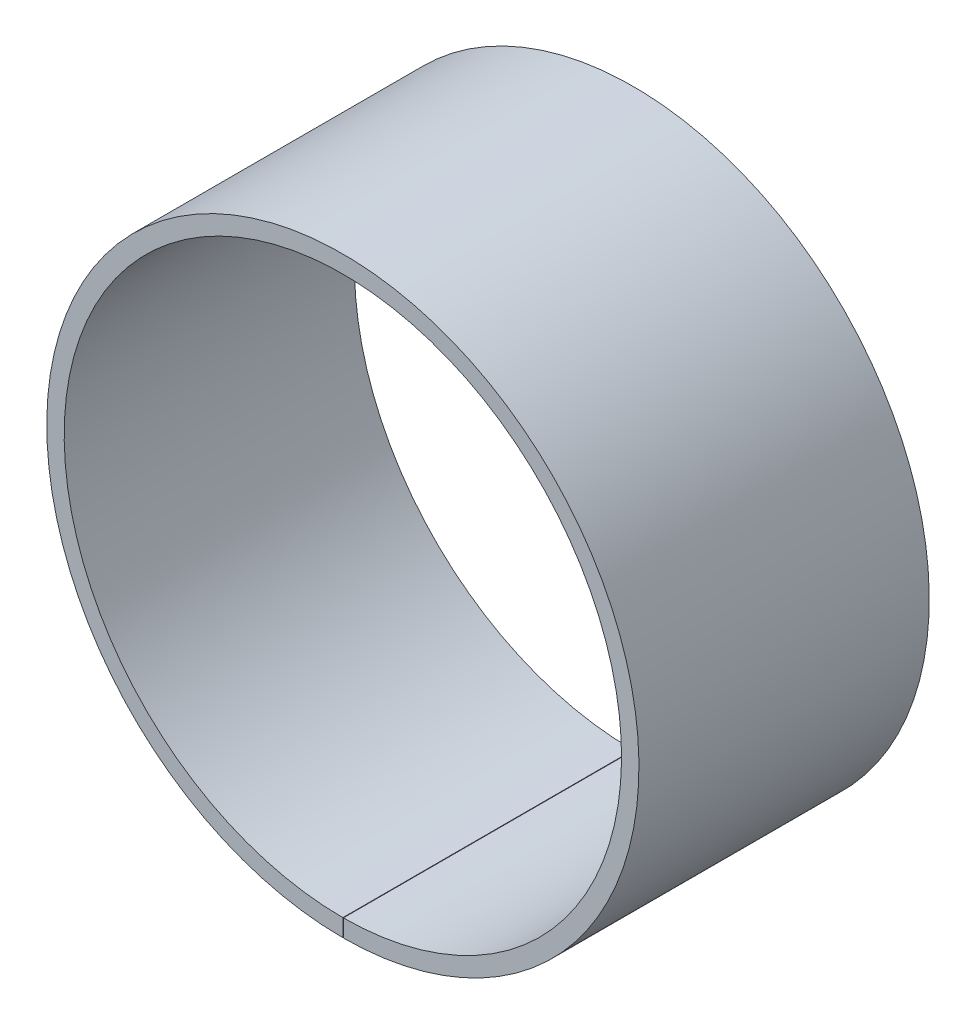
from build123d import *

# Parameters (mm, degrees)
BASE_FLANGE1_DEPTH = 50


# Sheet-metal steps are written as plain solids
with BuildPart() as part:
    # Sketch2 → Base-Flange1 (new body)
    with BuildSketch(Plane.XY):
        with BuildLine():
            ThreePointArc((0, -51), (-0.04450589, 50.999980581), (0.089011747, -50.999922323))
            Line((0.089011747, -50.999922323), (0.083775762, -47.999926892))
            ThreePointArc((0.083775762, -47.999926892), (-0.041887897, 47.999981723), (0, -48))
            Line((0, -48), (0, -51))
        make_face()
    extrude(amount=BASE_FLANGE1_DEPTH)


solid = part.part
